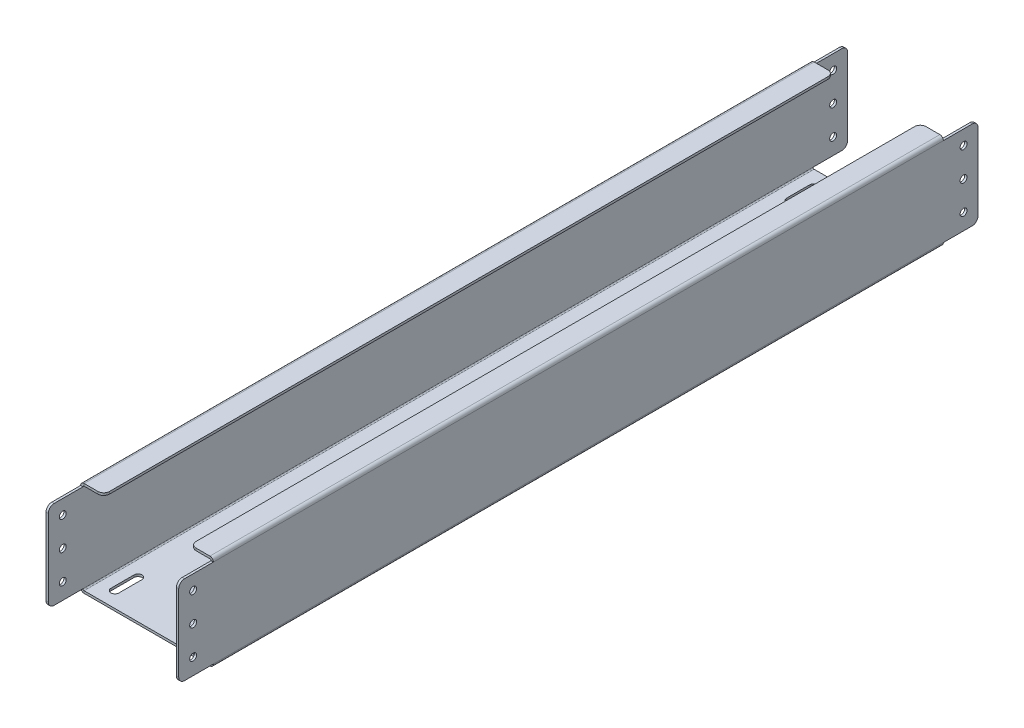
from build123d import *

# Parameters (mm, degrees)
BASE_FLANGE1_DEPTH = 1385
SKETCH6_W          = 60
SKETCH6_H          = 6
CUT_EXTRUDE1_DEPTH = 1414.63007891
SKETCH7_R          = 6
CUT_EXTRUDE2_DEPTH = 1414.63007891
FILLET1_R          = 10
SKETCH8_R          = 9
SKETCH8_W          = 52.5
SKETCH8_H          = 75
CUT_EXTRUDE3_DEPTH = 10


# Sheet-metal steps are written as plain solids
with BuildPart() as part:
    # Sketch1 → Base-Flange1 (new body)
    with BuildSketch(Plane.XY):
        with BuildLine():
            Line((40, 165), (6, 165))
            ThreePointArc((6, 165), (1.757359313, 163.242640687), (0, 159))
            Line((0, 159), (0, 6))
            ThreePointArc((0, 6), (1.757359313, 1.757359313), (6, 0))
            Line((6, 0), (224, 0))
            ThreePointArc((224, 0), (228.242640687, 1.757359313), (230, 6))
            Line((230, 6), (230, 159))
            ThreePointArc((230, 159), (228.242640687, 163.242640687), (224, 165))
            Line((224, 165), (190, 165))
            Line((190, 165), (190, 161))
            Line((190, 161), (224, 161))
            ThreePointArc((224, 161), (225.414213562, 160.414213562), (226, 159))
            Line((226, 159), (226, 6))
            ThreePointArc((226, 6), (225.414213562, 4.585786438), (224, 4))
            Line((224, 4), (6, 4))
            ThreePointArc((6, 4), (4.585786438, 4.585786438), (4, 6))
            Line((4, 6), (4, 159))
            ThreePointArc((4, 159), (4.585786438, 160.414213562), (6, 161))
            Line((6, 161), (40, 161))
            Line((40, 161), (40, 165))
        make_face()
    extrude(amount=BASE_FLANGE1_DEPTH)

    # Sketch6 → Cut-Extrude1 (cut, through all)
    with BuildSketch(Plane(origin=(0, 0, 0), x_dir=(0, 0, -1), z_dir=(1, 0, 0))):
        with Locations((-30, 162)):
            Rectangle(SKETCH6_W, SKETCH6_H)
        with Locations((-1355, 162)):
            Rectangle(SKETCH6_W, SKETCH6_H)
        with Locations((-1355, 3)):
            Rectangle(SKETCH6_W, SKETCH6_H)
        with Locations((-30, 3)):
            Rectangle(SKETCH6_W, SKETCH6_H)
    extrude(amount=CUT_EXTRUDE1_DEPTH, mode=Mode.SUBTRACT)

    # Sketch7 → Cut-Extrude2 (cut, through all)
    with BuildSketch(Plane.ZY):
        with Locations(Location((25, 134, 0), (0, 0, 270))):
            Circle(SKETCH7_R)
        with Locations(Location((25, 84, 0), (0, 0, 270))):
            Circle(SKETCH7_R)
        with Locations(Location((25, 34, 0), (0, 0, 270))):
            Circle(SKETCH7_R)
        with Locations((1360, 34)):
            Circle(SKETCH7_R)
        with Locations((1360, 84)):
            Circle(SKETCH7_R)
        with Locations((1360, 134)):
            Circle(SKETCH7_R)
    extrude(amount=-CUT_EXTRUDE2_DEPTH, mode=Mode.SUBTRACT)

    # Fillet1
    fillet1_edges = [part.edges().sort_by_distance(p)[0] for p in [
        (190, 163, 1325),
        (40, 163, 1325),
        (190, 163, 60),
        (40, 163, 60),
        (228, 159, 0),
        (228, 159, 1385),
        (228, 6, 0),
        (228, 6, 1385),
        (2, 6, 0),
        (2, 6, 1385),
        (2, 159, 0),
        (2, 159, 1385),
    ]]
    fillet(fillet1_edges, radius=FILLET1_R)

    # Sketch8 → Cut-Extrude3 (cut)
    with BuildSketch(Plane(origin=(0, 4, 0), x_dir=(1, 0, 0), z_dir=(0, 1, 0))):
        with Locations(Location((85, -767.5, 0), (0, 0, 270))):
            Circle(SKETCH8_R)
        with Locations(Location((145, -737.5, 0), (0, 0, 270))):
            Circle(SKETCH8_R)
        with Locations(Location((145, -677.5, 0), (0, 0, 270))):
            Circle(SKETCH8_R)
        with Locations(Location((145, -617.5, 0), (0, 0, 270))):
            Circle(SKETCH8_R)
        with Locations(Location((85, -707.5, 0), (0, 0, 270))):
            Circle(SKETCH8_R)
        with Locations(Location((85, -647.5, 0), (0, 0, 270))):
            Circle(SKETCH8_R)
        with Locations((151.25, -1112.5)):
            Rectangle(SKETCH8_W, SKETCH8_H)
        with Locations((78.75, -1112.5)):
            Rectangle(SKETCH8_W, SKETCH8_H)
        with Locations((78.75, -272.5)):
            Rectangle(SKETCH8_W, SKETCH8_H)
        with Locations((151.25, -272.5)):
            Rectangle(SKETCH8_W, SKETCH8_H)
        with BuildLine():
            Line((190.5, -1298), (190.5, -1258))
            ThreePointArc((190.5, -1258), (197.5, -1251), (204.5, -1258))
            Line((204.5, -1258), (204.5, -1298))
            ThreePointArc((204.5, -1298), (197.5, -1305), (190.5, -1298))
        make_face()
        with BuildLine():
            Line((39.5, -1298), (39.5, -1258))
            ThreePointArc((39.5, -1258), (32.5, -1251), (25.5, -1258))
            Line((25.5, -1258), (25.5, -1298))
            ThreePointArc((25.5, -1298), (32.5, -1305), (39.5, -1298))
        make_face()
        with BuildLine():
            Line((39.5, -87), (39.5, -127))
            ThreePointArc((39.5, -127), (32.5, -134), (25.5, -127))
            Line((25.5, -127), (25.5, -87))
            ThreePointArc((25.5, -87), (32.5, -80), (39.5, -87))
        make_face()
        with BuildLine():
            Line((190.5, -87), (190.5, -127))
            ThreePointArc((190.5, -127), (197.5, -134), (204.5, -127))
            Line((204.5, -127), (204.5, -87))
            ThreePointArc((204.5, -87), (197.5, -80), (190.5, -87))
        make_face()
    extrude(amount=-CUT_EXTRUDE3_DEPTH, mode=Mode.SUBTRACT)


solid = part.part
